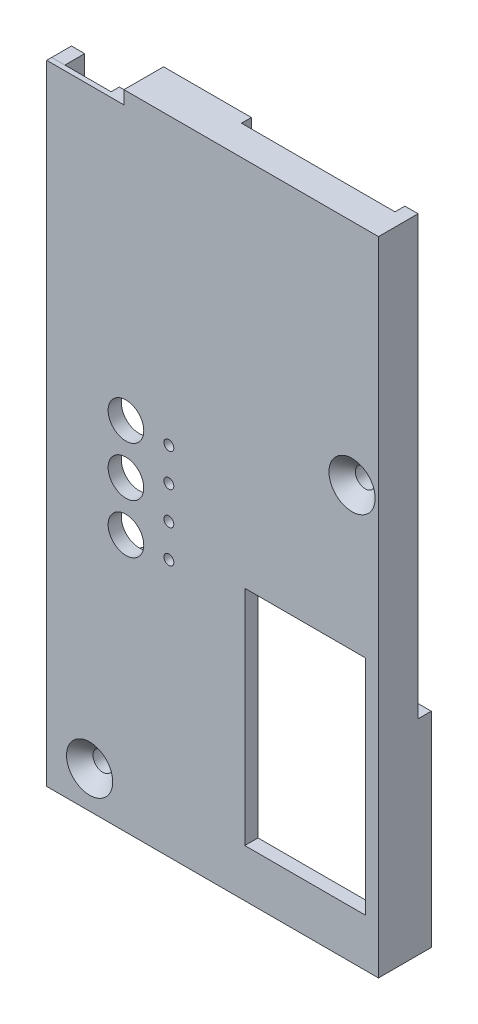
from build123d import *

# Parameters (mm, degrees)
SKETCH1_W               = 50.25
SKETCH1_H               = 97.25
BOSS_EXTRUDE1_DEPTH     = 2
SKETCH2_R               = 2.7
SKETCH2_R_2             = 1.5
SKETCH2_R_3             = 0.75
SKETCH2_W               = 18.25
SKETCH2_H               = 33.75
CUT_EXTRUDE1_DEPTH      = 110.483446237
SKETCH3_W               = 50.25
SKETCH3_H               = 97.25
SKETCH3_W_2             = 46.25
SKETCH3_H_2             = 93.25
BOSS_EXTRUDE2_DEPTH     = 4
SKETCH4_R               = 3
SKETCH4_R_2             = 1.5
BOSS_EXTRUDE3_DEPTH     = 4
CUT_EXTRUDE2_DEPTH      = 4
SKETCH7_W               = 2
SKETCH7_H               = 97.25
CUT_EXTRUDE3_DEPTH      = 1
CUT_EXTRUDE4_DEPTH      = 110.538235334
CUT_EXTRUDE4_DEPTH_BACK = 110.538235334
SKETCH8_W               = 11.7
SKETCH8_H               = 2
CUT_EXTRUDE5_DEPTH      = 110.538235334
CUT_EXTRUDE5_DEPTH_BACK = 1.25
SKETCH9_W               = 9
SKETCH9_H               = 7
SKETCH10_R              = 2.25
SKETCH10_R_2            = 0.75
BOSS_EXTRUDE4_DEPTH     = 2.5
SKETCH11_W              = 23.25
SKETCH11_H              = 2
CUT_EXTRUDE6_DEPTH      = 1.5
CHAMFER1_SIZE           = 2
SKETCH12_R              = 3
BOSS_EXTRUDE5_DEPTH     = 4
SKETCH13_W              = 4
SKETCH13_H              = 31
BOSS_EXTRUDE6_DEPTH     = 2
SKETCH14_W              = 2
SKETCH14_H              = 5
BOSS_EXTRUDE9_DEPTH     = 3


with BuildPart() as part:
    # Sketch1 → Boss-Extrude1 (new body)
    with BuildSketch(Plane.XY):
        with Locations((25.125, -48.625)):
            Rectangle(SKETCH1_W, SKETCH1_H)
    extrude(amount=BOSS_EXTRUDE1_DEPTH)

    # Sketch2 → Cut-Extrude1 (cut, through all)
    with BuildSketch(Plane.XY.offset(2)):
        with Locations((12, -43.25)):
            Circle(SKETCH2_R)
        with Locations((12, -50.75)):
            Circle(SKETCH2_R)
        with Locations((12, -58.25)):
            Circle(SKETCH2_R)
        with Locations((46.25, -34.59)):
            Circle(SKETCH2_R_2)
        with Locations((6.5, -91.65)):
            Circle(SKETCH2_R_2)
        with Locations((18.5, -43.25)):
            Circle(SKETCH2_R_3)
        with Locations((18.5, -48.25)):
            Circle(SKETCH2_R_3)
        with Locations((18.5, -53.25)):
            Circle(SKETCH2_R_3)
        with Locations((18.5, -58.25)):
            Circle(SKETCH2_R_3)
        with Locations((39.125, -73.125)):
            Rectangle(SKETCH2_W, SKETCH2_H)
    extrude(amount=-CUT_EXTRUDE1_DEPTH, mode=Mode.SUBTRACT)

    # Sketch3 → Boss-Extrude2 (add)
    with BuildSketch(Plane(origin=(0, 0, 0), x_dir=(-1, 0, 0), z_dir=(0, 0, -1))):
        with Locations((-25.125, -48.625)):
            Rectangle(SKETCH3_W, SKETCH3_H)
        with Locations((-25.125, -48.625)):
            Rectangle(SKETCH3_W_2, SKETCH3_H_2, mode=Mode.SUBTRACT)
    extrude(amount=BOSS_EXTRUDE2_DEPTH)

    # Sketch4 → Boss-Extrude3 (add)
    # profile 1 of 2: a face of its own
    with BuildSketch(Plane(origin=(0, 0, 0), x_dir=(-1, 0, 0), z_dir=(0, 0, -1))):
        with Locations(Location((-6.5, -91.65, 0), (0, 0, 180))):
            Circle(SKETCH4_R)
        with Locations(Location((-6.5, -91.65, 0), (0, 0, 180))):
            Circle(SKETCH4_R_2, mode=Mode.SUBTRACT)
    # profile 2 of 2: a face of its own
    with BuildSketch(Plane(origin=(0, 0, 0), x_dir=(-1, 0, 0), z_dir=(0, 0, -1))):
        with BuildLine():
            Line((-46.25, -31.59), (-48.25, -31.59))
            Line((-48.25, -31.59), (-48.25, -37.59))
            Line((-48.25, -37.59), (-46.25, -37.59))
            ThreePointArc((-46.25, -37.59), (-43.25, -34.59), (-46.25, -31.59))
        make_face()
        with Locations(Location((-46.25, -34.59, 0), (0, 0, 180))):
            Circle(SKETCH4_R_2, mode=Mode.SUBTRACT)
    extrude(amount=BOSS_EXTRUDE3_DEPTH)

    # Sketch6 → Cut-Extrude2 (cut)
    with BuildSketch(Plane(origin=(0, 0, -4), x_dir=(-1, 0, 0), z_dir=(0, 0, -1))):
        Polygon((-11.7, 0), (0, 0), (0, -97.25), (-2, -97.25), (-2, -2), (-11.7, -2), align=None)
    extrude(amount=-CUT_EXTRUDE2_DEPTH, mode=Mode.SUBTRACT)

    # Sketch7 → Cut-Extrude3 (cut)
    with BuildSketch(Plane(origin=(0, 0, 0), x_dir=(-1, 0, 0), z_dir=(0, 0, -1))):
        with Locations((-1, -48.625)):
            Rectangle(SKETCH7_W, SKETCH7_H)
    extrude(amount=-CUT_EXTRUDE3_DEPTH, mode=Mode.SUBTRACT)

    # Sketch8 → Cut-Extrude4 (cut, two sides: drawn at the far end of the back side and taken through both)
    with BuildSketch(Plane(origin=(0, 0, 0), x_dir=(-1, 0, 0), z_dir=(0, 0, -1)).offset(-CUT_EXTRUDE4_DEPTH_BACK)):
        with Locations((-5.85, -1)):
            Rectangle(SKETCH8_W, SKETCH8_H)
    extrude(amount=CUT_EXTRUDE4_DEPTH + CUT_EXTRUDE4_DEPTH_BACK, mode=Mode.SUBTRACT)

    # Sketch9 → Cut-Extrude5 (cut, two sides: drawn at the far end of the back side and taken through both)
    with BuildSketch(Plane(origin=(0, 0, 0), x_dir=(-1, 0, 0), z_dir=(0, 0, -1)).offset(-CUT_EXTRUDE5_DEPTH_BACK)):
        with Locations((-4.5, -3.5)):
            Rectangle(SKETCH9_W, SKETCH9_H)
    extrude(amount=CUT_EXTRUDE5_DEPTH + CUT_EXTRUDE5_DEPTH_BACK, mode=Mode.SUBTRACT)

    # Sketch10 → Boss-Extrude4 (add)
    # profile 1 of 4: a face of its own
    with BuildSketch(Plane(origin=(0, 0, 0), x_dir=(-1, 0, 0), z_dir=(0, 0, -1))):
        with Locations(Location((-18.5, -58.25, 0), (0, 0, 180))):
            Circle(SKETCH10_R)
        with Locations(Location((-18.5, -58.25, 0), (0, 0, 180))):
            Circle(SKETCH10_R_2, mode=Mode.SUBTRACT)
    # profile 2 of 4: a face of its own
    with BuildSketch(Plane(origin=(0, 0, 0), x_dir=(-1, 0, 0), z_dir=(0, 0, -1))):
        with Locations(Location((-18.5, -53.25, 0), (0, 0, 180))):
            Circle(SKETCH10_R)
        with Locations(Location((-18.5, -53.25, 0), (0, 0, 180))):
            Circle(SKETCH10_R_2, mode=Mode.SUBTRACT)
    # profile 3 of 4: a face of its own
    with BuildSketch(Plane(origin=(0, 0, 0), x_dir=(-1, 0, 0), z_dir=(0, 0, -1))):
        with Locations(Location((-18.5, -48.25, 0), (0, 0, 180))):
            Circle(SKETCH10_R)
        with Locations(Location((-18.5, -48.25, 0), (0, 0, 180))):
            Circle(SKETCH10_R_2, mode=Mode.SUBTRACT)
    # profile 4 of 4: a face of its own
    with BuildSketch(Plane(origin=(0, 0, 0), x_dir=(-1, 0, 0), z_dir=(0, 0, -1))):
        with Locations(Location((-18.5, -43.25, 0), (0, 0, 180))):
            Circle(SKETCH10_R)
        with Locations(Location((-18.5, -43.25, 0), (0, 0, 180))):
            Circle(SKETCH10_R_2, mode=Mode.SUBTRACT)
    extrude(amount=BOSS_EXTRUDE4_DEPTH)

    # Sketch11 → Cut-Extrude6 (cut)
    with BuildSketch(Plane(origin=(0, 0, -4), x_dir=(-1, 0, 0), z_dir=(0, 0, -1))):
        with Locations((-36.625, -1)):
            Rectangle(SKETCH11_W, SKETCH11_H)
    extrude(amount=-CUT_EXTRUDE6_DEPTH, mode=Mode.SUBTRACT)

    # Chamfer1
    chamfer1_edges = [part.edges().sort_by_distance(p)[0] for p in [
        (5, -91.65, 2),
        (44.75, -34.59, 2),
    ]]
    chamfer(chamfer1_edges, length=CHAMFER1_SIZE - 0.0001)  # a hair under: the kernel refuses the full size

    # Sketch12 → Boss-Extrude5 (add)
    with BuildSketch(Plane(origin=(0, 0, 0), x_dir=(-1, 0, 0), z_dir=(0, 0, -1))):
        with Locations(Location((-10, -13.25, 0), (0, 0, 180))):
            Circle(SKETCH12_R)
        with Locations(Location((-11, -33, 0), (0, 0, 180))):
            Circle(SKETCH12_R)
        with Locations(Location((-10, -67.25, 0), (0, 0, 180))):
            Circle(SKETCH12_R)
        with Locations(Location((-10, -77.25, 0), (0, 0, 180))):
            Circle(SKETCH12_R)
        with Locations(Location((-39, -44.25, 0), (0, 0, 180))):
            Circle(SKETCH12_R)
    extrude(amount=BOSS_EXTRUDE5_DEPTH)

    # Sketch13 → Boss-Extrude6 (add)
    with BuildSketch(Plane(origin=(0, 0, -4), x_dir=(-1, 0, 0), z_dir=(0, 0, -1))):
        with Locations((-48.25, -81.75)):
            Rectangle(SKETCH13_W, SKETCH13_H)
    extrude(amount=BOSS_EXTRUDE6_DEPTH)


with BuildPart() as body_2:
    # Sketch14 → Boss-Extrude9 (new body)
    with BuildSketch(Plane(origin=(0, 0, 1.25), x_dir=(-1, 0, 0), z_dir=(0, 0, -1))):
        with Locations((-1, -4.5)):
            Rectangle(SKETCH14_W, SKETCH14_H)
    extrude(amount=BOSS_EXTRUDE9_DEPTH)


solid = Compound([part.part, body_2.part])
